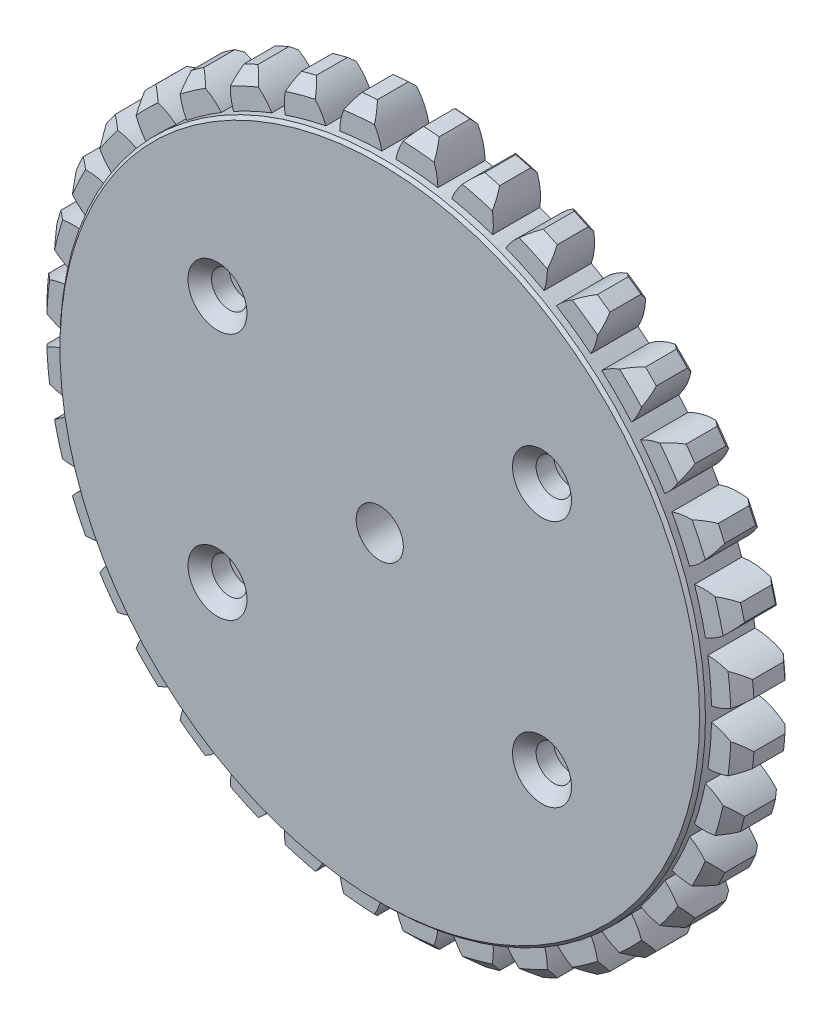
from build123d import *
from build123d.topology import SkipClean

# Parameters (mm, degrees)
SKETCH1_R               = 60
GEAR_BLANK_DEPTH        = 4
FRONT_GEAR_CHAMFER_SIZE = 2
REAR_GEAR_CHAMFER_SIZE  = 0.75
TOOTH_CUT_DEPTH         = 4
TOOTH_COPIES_COUNT      = 36
BOSS_EXTRUDE1_START     = 1.54
SKETCH3_R               = 54.7
BOSS_EXTRUDE1_DEPTH     = 1.54
CHAMFER1_SIZE           = 0.5
SKETCH4_R               = 4
SKETCH4_R_2             = 1.5
CUT_EXTRUDE1_DEPTH      = 10
SKETCH5_R               = 3
CUT_EXTRUDE2_DEPTH      = 5
CHAMFER2_SIZE           = 2


with BuildPart() as part:
    # Sketch1 → Gear Blank (new, symmetric)
    with BuildSketch(Plane.XY):
        Circle(SKETCH1_R)
    extrude(amount=GEAR_BLANK_DEPTH, both=True)

    # Front Gear Chamfer
    front_gear_chamfer_edges = [part.edges().sort_by_distance(p)[0] for p in [
        (-60, 0, 4),
    ]]
    chamfer(front_gear_chamfer_edges, length=FRONT_GEAR_CHAMFER_SIZE)

    # Rear Gear Chamfer
    rear_gear_chamfer_edges = [part.edges().sort_by_distance(p)[0] for p in [
        (-60, 0, -4),
    ]]
    chamfer(rear_gear_chamfer_edges, length=REAR_GEAR_CHAMFER_SIZE)

    # Sketch2 → Tooth Cut (cut, symmetric)
    with BuildSketch(Plane.XY):
        with BuildLine():
            ThreePointArc((3.924160057, 59.87153721), (-2.7756e-05, 60), (-3.92421545, 59.871533579))
            ThreePointArc((-3.92421545, 59.871533579), (-2.170481149, 57.483779034), (-1.19329951, 54.686982329))
            ThreePointArc((-1.19329951, 54.686982329), (-2.5304e-05, 54.7), (1.193248913, 54.686983433))
            ThreePointArc((1.193248913, 54.686983433), (2.170427965, 57.483781042), (3.924160057, 59.87153721))
        make_face()
    tooth_cut = extrude(amount=TOOTH_CUT_DEPTH, both=True, mode=Mode.SUBTRACT)

    # Tooth Copies: Tooth Cut ×36 about axis
    tooth_copies_axis = Axis((0, 0, 0), (0, 0, 1))
    for i in range(1, TOOTH_COPIES_COUNT):
        add(tooth_cut.rotate(tooth_copies_axis, i * 360 / TOOTH_COPIES_COUNT), mode=Mode.SUBTRACT)

    # Sketch3 → Boss-Extrude1 (add)
    with SkipClean():  # the faces are left unmerged after this step: merging them gives an invalid solid
        with BuildSketch(Plane.XY.offset(4).offset(BOSS_EXTRUDE1_START)):
            Circle(SKETCH3_R)
        extrude(amount=-BOSS_EXTRUDE1_DEPTH)

    # Chamfer1
    chamfer1_edges = [part.edges().sort_by_distance(p)[0] for p in [
        (-54.7, 0, 5.54),
    ]]
    chamfer(chamfer1_edges, length=CHAMFER1_SIZE)

    # Sketch4 → Cut-Extrude1 (cut)
    with SkipClean():  # the faces are left unmerged after this step: merging them gives an invalid solid
        with BuildSketch(Plane(origin=(0, 0, -4), x_dir=(-1, 0, 0), z_dir=(0, 0, -1))):
            Circle(SKETCH4_R)
            with Locations((27.5, -21)):
                Circle(SKETCH4_R_2)
            with Locations((27.5, 21)):
                Circle(SKETCH4_R_2)
            with Locations((-27.5, 21)):
                Circle(SKETCH4_R_2)
            with Locations((-27.5, -21)):
                Circle(SKETCH4_R_2)
        extrude(amount=-CUT_EXTRUDE1_DEPTH, mode=Mode.SUBTRACT)

    # Sketch5 → Cut-Extrude2 (cut)
    with SkipClean():  # the faces are left unmerged after this step: merging them gives an invalid solid
        with BuildSketch(Plane.XY.offset(5.54)):
            with Locations((-27.5, 21)):
                Circle(SKETCH5_R)
            with Locations((27.5, -21)):
                Circle(SKETCH5_R)
            with Locations((-27.5, -21)):
                Circle(SKETCH5_R)
            with Locations((27.5, 21)):
                Circle(SKETCH5_R)
        extrude(amount=-CUT_EXTRUDE2_DEPTH, mode=Mode.SUBTRACT)

    # Chamfer2
    chamfer2_edges = [part.edges().sort_by_distance(p)[0] for p in [
        (24.5, -21, 5.54),
        (-30.5, -21, 5.54),
        (-30.5, 21, 5.54),
        (24.5, 21, 5.54),
    ]]
    chamfer(chamfer2_edges, length=CHAMFER2_SIZE)


solid = part.part
